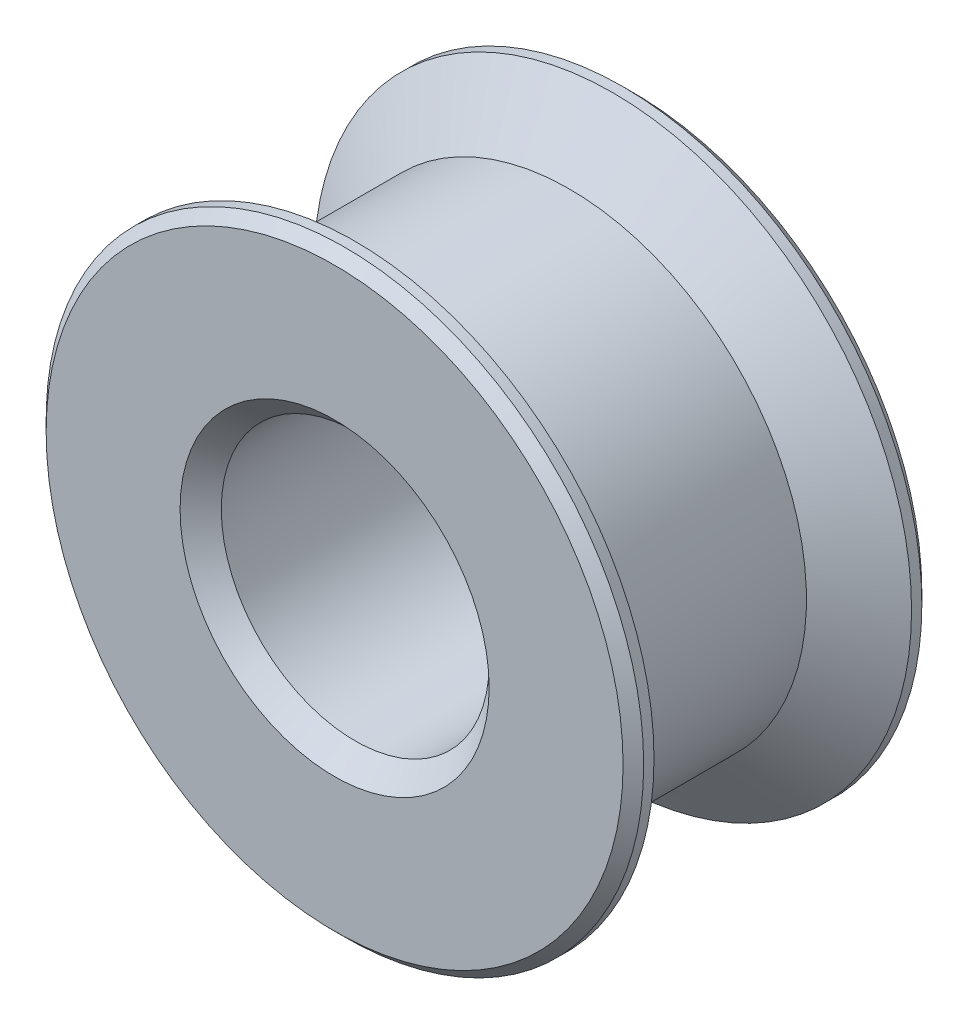
from build123d import *

# Parameters (mm, degrees)
SKETCH1_R           = 11.5
SKETCH1_R_2         = 6.5
BOSS_EXTRUDE1_DEPTH = 6.25
SKETCH2_R           = 14.5
SKETCH2_R_2         = 6.5
BOSS_EXTRUDE2_DEPTH = 1
CHAMFER1_SIZE       = 2.100622615
CHAMFER1_SIZE_2     = 3
CHAMFER2_SIZE       = 1
CHAMFER3_SIZE       = 0.5


with BuildPart() as part:
    # Sketch1 → Boss-Extrude1 (new, symmetric)
    with BuildSketch(Plane.XY):
        Circle(SKETCH1_R)
        Circle(SKETCH1_R_2, mode=Mode.SUBTRACT)
    extrude(amount=BOSS_EXTRUDE1_DEPTH, both=True)

    # Sketch2 → Boss-Extrude2 (add)
    with BuildSketch(Plane.XY.offset(6.25)):
        Circle(SKETCH2_R)
        Circle(SKETCH2_R_2, mode=Mode.SUBTRACT)
    boss_extrude2 = extrude(amount=BOSS_EXTRUDE2_DEPTH)

    # Mirror1: Boss-Extrude2 across plane
    add(boss_extrude2.mirror(Plane.XY))

    # Chamfer1
    # the kernel refuses this chamfer: 3, 2.100622615 mm, written as the material it adds along each edge
    with BuildSketch(Plane(origin=(0, 0, -6.25), x_dir=(1, 0, 0), z_dir=(0, -1, 0))) as chamfer1_piece_1_section:
        Polygon((11.5, CHAMFER1_SIZE), (11.5 + CHAMFER1_SIZE_2, 0), (11.5, 0), align=None)
    chamfer1_piece_1 = revolve(axis=Axis((0, 0, -6.25), (0, 0, 1)), mode=Mode.PRIVATE)
    chamfer1_piece_1 = chamfer1_piece_1 & Plane(origin=(0, 0, -5.218650002), x_dir=(1, 0, 0), z_dir=(0, 0, 1)) * Cylinder(14.5, 58, mode=Mode.PRIVATE)
    add(chamfer1_piece_1)
    with BuildSketch(Plane(origin=(0, 0, 6.25), x_dir=(1, 0, 0), z_dir=(0, -1, 0))) as chamfer1_piece_2_section:
        Polygon((11.5, -CHAMFER1_SIZE), (11.5 + CHAMFER1_SIZE_2, 0), (11.5, 0), align=None)
    chamfer1_piece_2 = revolve(axis=Axis((0, 0, 6.25), (0, 0, 1)), mode=Mode.PRIVATE)
    chamfer1_piece_2 = chamfer1_piece_2 & Plane(origin=(0, 0, 5.218650002), x_dir=(1, 0, 0), z_dir=(0, 0, -1)) * Cylinder(14.5, 58, mode=Mode.PRIVATE)
    add(chamfer1_piece_2)

    # Chamfer2
    chamfer2_edges = [part.edges().sort_by_distance(p)[0] for p in [
        (-6.5, 0, 7.25),
        (-6.5, 0, -7.25),
    ]]
    chamfer(chamfer2_edges, length=CHAMFER2_SIZE)

    # Chamfer3
    chamfer3_edges = [part.edges().sort_by_distance(p)[0] for p in [
        (-14.5, 0, 7.25),
        (-14.5, 0, -7.25),
    ]]
    chamfer(chamfer3_edges, length=CHAMFER3_SIZE)


solid = part.part
